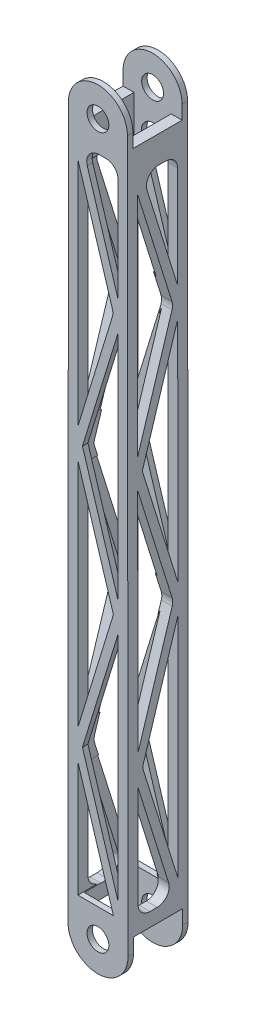
from build123d import *

# Parameters (mm, degrees)
SKETCH1_R               = 10
BOSS_EXTRUDE2_DEPTH     = 5
BOSS_EXTRUDE3_DEPTH     = 55
BOSS_EXTRUDE4_START     = 50
SKETCH1_4_R             = 10
BOSS_EXTRUDE4_DEPTH     = 5
CUT_EXTRUDE2_DEPTH      = 682.432576538
CUT_EXTRUDE2_DEPTH_BACK = 682.432576538
CUT_EXTRUDE4_DEPTH      = 680.786915143
CUT_EXTRUDE4_DEPTH_BACK = 680.786915143
FILLET1_R               = 11
FILLET2_R               = 11


with BuildPart() as part:
    # Sketch1 → Boss-Extrude2 (new body)
    with BuildSketch(Plane.XY):
        with BuildLine():
            Line((27.00967764, 637.419067567), (27, 650))
            ThreePointArc((27, 650), (11.628325989, 674.367643191), (-16.983854422, 670.989251749))
            ThreePointArc((-16.983854422, 670.989251749), (-24.367643191, 661.628325989), (-27, 650))
            Line((-27, 650), (-27.00967764, 637.419067567))
            Line((-27.00967764, 637.419067567), (-17.00967764, 637.419067567))
            Line((-17.00967764, 637.419067567), (-17.490017949, 12.976666451))
            Line((-17.490017949, 12.976666451), (-27.490017949, 12.976666451))
            Line((-27.490017949, 12.976666451), (-27.5, 0))
            ThreePointArc((-27.5, 0), (0, -27.5), (27.5, 0))
            Line((27.5, 0), (27.490017949, 12.976666451))
            Line((27.490017949, 12.976666451), (17.490017949, 12.976666451))
            Line((17.490017949, 12.976666451), (17.00967764, 637.419067567))
            Line((17.00967764, 637.419067567), (27.00967764, 637.419067567))
        make_face()
        Circle(SKETCH1_R, mode=Mode.SUBTRACT)
        with Locations((0, 650)):
            Circle(SKETCH1_R, mode=Mode.SUBTRACT)
    extrude(amount=BOSS_EXTRUDE2_DEPTH)

    # Sketch1<3> → Boss-Extrude3 (add)
    with BuildSketch(Plane.XY):
        Polygon((27.490017949, 12.976666451), (27.00967764, 637.419067567), (17.00967764, 637.419067567), (17.490017949, 12.976666451), align=None)
        Polygon((-17.00967764, 637.419067567), (-27.00967764, 637.419067567), (-27.490017949, 12.976666451), (-17.490017949, 12.976666451), align=None)
    extrude(amount=BOSS_EXTRUDE3_DEPTH)

    # Sketch1<4> → Boss-Extrude4 (add)
    with BuildSketch(Plane.XY.offset(BOSS_EXTRUDE4_START)):
        with BuildLine():
            Line((27, 650), (27.5, 0))
            ThreePointArc((27.5, 0), (0, -27.5), (-27.5, 0))
            Line((-27.5, 0), (-27, 650))
            ThreePointArc((-27, 650), (0, 677), (27, 650))
        make_face()
        Circle(SKETCH1_4_R, mode=Mode.SUBTRACT)
        with Locations((0, 650)):
            Circle(SKETCH1_4_R, mode=Mode.SUBTRACT)
    extrude(amount=BOSS_EXTRUDE4_DEPTH)

    # Sketch3 → Cut-Extrude2 (cut, two sides: drawn at the far end of the back side and taken through both)
    with BuildSketch(Plane(origin=(27.499983728, 0.021153834, 0), x_dir=(0, 0, -1), z_dir=(0.9999997041421431, 0.0007692305416477978, 0)).offset(-CUT_EXTRUDE2_DEPTH_BACK)):
        Polygon((-9.15125207, 39.004247167), (-9.15125207, 246.975679911), (-41.657857257, 142.989963539), align=None)
        Polygon((-45.84874793, 25.600016011), (-13.342784359, 25.600016011), (-45.84874793, 129.583679911), align=None)
        Polygon((-13.342142743, 260.381963539), (-45.84874793, 364.367679911), (-45.84874793, 156.396247167), align=None)
        Polygon((-9.15125207, 273.788247167), (-9.15125207, 481.759679911), (-41.657857257, 377.773963539), align=None)
        Polygon((-9.15125207, 508.572247167), (-9.15125207, 612.557963539), (-41.657857257, 612.557963539), align=None)
        Polygon((-13.342142743, 495.165963539), (-45.84874793, 599.151679911), (-45.84874793, 391.180247167), align=None)
    extrude(amount=CUT_EXTRUDE2_DEPTH + CUT_EXTRUDE2_DEPTH_BACK, mode=Mode.SUBTRACT)

    # Sketch4 → Cut-Extrude4 (cut, two sides: drawn at the far end of the back side and taken through both)
    with BuildSketch(Plane.XY.offset(55).offset(-CUT_EXTRUDE4_DEPTH_BACK)):
        Polygon((14.164977662, 264.312281668), (-18.35, 369.999248569), (-18.35, 158.625314767), align=None)
        Polygon((18.35, 277.915314767), (18.35, 383.602281668), (-14.164977662, 383.602281668), align=None)
        Polygon((18.35, 39.335314767), (18.35, 250.709248569), (-14.164977662, 145.022281668), align=None)
        Polygon((14.164977662, 502.892281668), (-18.35, 608.579248569), (-18.35, 397.205314767), align=None)
        Polygon((18.35, 383.602281668), (18.35, 489.289248569), (-14.164977662, 383.602281668), align=None)
        Polygon((18.35, 516.495314767), (18.35, 622.182281668), (-14.164977662, 622.182281668), align=None)
        Polygon((14.164712586, 25.733143274), (-18.35, 131.419248569), (-18.35, 25.733143274), align=None)
    extrude(amount=CUT_EXTRUDE4_DEPTH + CUT_EXTRUDE4_DEPTH_BACK, mode=Mode.SUBTRACT)

    # Fillet1
    # the kernel refuses this fillet: 11 mm, written as the material it adds along each edge
    with BuildSketch(Plane(origin=(20.380228063, 612.573821868, 41.657857257), x_dir=(0, 0, -1), z_dir=(-0.9999997041421432, -0.0007692305416478183, 0))) as fillet1_piece_1_section:
        with BuildLine():
            CenterArc((FILLET1_R * 1.36032911396, FILLET1_R), FILLET1_R, 162.640419254, 107.359580746)
            Line((FILLET1_R * 0.405878064858, FILLET1_R * 1.29836754995), (0, 0))
            Line((0, 0), (FILLET1_R * 1.36032911396, 0))
        make_face()
    fillet1_piece_1 = extrude(amount=84.818110144, mode=Mode.PRIVATE)
    fillet1_piece_1 = split(fillet1_piece_1, bisect_by=Plane(origin=(-17.030633595, 610.176326445, 36.866673166), z_dir=(-0.9999997041421432, 0.000769230541647673, 0)), keep=Keep.TOP, mode=Mode.PRIVATE)
    fillet1_piece_1 = split(fillet1_piece_1, bisect_by=Plane(origin=(-18.73880131, 609.843011736, 36.866673166), z_dir=(0.9557894024833086, 0.2940520669891645, 0)), keep=Keep.TOP, mode=Mode.PRIVATE)
    add(fillet1_piece_1)
    with BuildSketch(Plane(origin=(20.380228063, 612.573821868, 41.657857257), x_dir=(0, 0, -1), z_dir=(-0.9999997041421432, -0.0007692305416478183, 0))) as fillet1_piece_2_section:
        with BuildLine():
            CenterArc((FILLET1_R * 1.36032911396, FILLET1_R), FILLET1_R, 162.640419254, 107.359580746)
            Line((FILLET1_R * 0.405878064858, FILLET1_R * 1.29836754995), (0, 0))
            Line((0, 0), (FILLET1_R * 1.36032911396, 0))
        make_face()
    fillet1_piece_2 = extrude(amount=84.818110144, mode=Mode.PRIVATE)
    fillet1_piece_2 = split(fillet1_piece_2, bisect_by=Plane(origin=(-27.031488651, 609.064753274, 37.148122223), z_dir=(0.9999997041421432, -0.0007692305416479086, 0)), keep=Keep.TOP, mode=Mode.PRIVATE)
    fillet1_piece_2 = split(fillet1_piece_2, bisect_by=Plane(origin=(-18.35, 609.061582513, 37.148122223), z_dir=(-1, 0, 0)), keep=Keep.TOP, mode=Mode.PRIVATE)
    add(fillet1_piece_2)
    with BuildSketch(Plane(origin=(-54.528809284, 612.516199531, 9.15125207), x_dir=(0, 0, 1), z_dir=(0.9999997041421432, 0.0007692305416478183, 0))) as fillet1_piece_3_section:
        with BuildLine():
            CenterArc((FILLET1_R, FILLET1_R), FILLET1_R, 180, 90)
            Line((0, FILLET1_R), (0, 0))
            Line((0, 0), (FILLET1_R, 0))
        make_face()
    fillet1_piece_3 = extrude(amount=65.000008876, mode=Mode.PRIVATE)
    fillet1_piece_3 = split(fillet1_piece_3, bisect_by=Plane(origin=(-27.030780425, 609.985446876, 11.541019747), z_dir=(0.9999997041421432, -0.0007692305416479086, 0)), keep=Keep.TOP, mode=Mode.PRIVATE)
    fillet1_piece_3 = split(fillet1_piece_3, bisect_by=Plane(origin=(-18.35, 609.982321929, 11.541019747), z_dir=(-1, 0, 0)), keep=Keep.TOP, mode=Mode.PRIVATE)
    add(fillet1_piece_3)
    with BuildSketch(Plane(origin=(-54.528809284, 612.516199531, 9.15125207), x_dir=(0, 0, 1), z_dir=(0.9999997041421432, 0.0007692305416478183, 0))) as fillet1_piece_4_section:
        with BuildLine():
            CenterArc((FILLET1_R, FILLET1_R), FILLET1_R, 180, 90)
            Line((0, FILLET1_R), (0, 0))
            Line((0, 0), (FILLET1_R, 0))
        make_face()
    fillet1_piece_4 = extrude(amount=65.000008876, mode=Mode.PRIVATE)
    fillet1_piece_4 = split(fillet1_piece_4, bisect_by=Plane(origin=(-18.826050938, 610.126608689, 11.792449783), z_dir=(0.9557894024833086, 0.2940520669891645, 0)), keep=Keep.TOP, mode=Mode.PRIVATE)
    fillet1_piece_4 = split(fillet1_piece_4, bisect_by=Plane(origin=(-17.030397772, 610.482896731, 11.792449783), z_dir=(-0.9999997041421432, 0.000769230541647673, 0)), keep=Keep.TOP, mode=Mode.PRIVATE)
    add(fillet1_piece_4)
    with BuildSketch(Plane(origin=(27.480291414, 25.621162271, 13.342784359), x_dir=(-0.0007341928974791893, 0.9544507667229525, 0.2983675499493158), z_dir=(-0.9999997041421432, -0.0007692305416477974, 0))) as fillet1_piece_5_section:
        with BuildLine():
            CenterArc((FILLET1_R * 1.36032911396, -FILLET1_R), FILLET1_R, 90, 107.359580746)
            Line((FILLET1_R * 0.405878064858, -FILLET1_R * 1.29836754995), (0, 0))
            Line((0, 0), (FILLET1_R * 1.36032911396, 0))
        make_face()
    fillet1_piece_5 = extrude(amount=47.409047675, mode=Mode.PRIVATE)
    fillet1_piece_5 = split(fillet1_piece_5, bisect_by=Plane(origin=(18.35, 29.459204727, 17.720701892), z_dir=(1, 0, 0)), keep=Keep.TOP, mode=Mode.PRIVATE)
    add(fillet1_piece_5)
    with BuildSketch(Plane(origin=(64.88933098, 25.649938455, 13.342784359), x_dir=(-0.0007341928974791892, 0.9544507667229523, 0.29836754994931636), z_dir=(-0.9999997041421432, -0.0007692305416477974, 0))) as fillet1_piece_6_section:
        with BuildLine():
            CenterArc((FILLET1_R * 1.36032911396, -FILLET1_R), FILLET1_R, 90, 107.359580746)
            Line((FILLET1_R * 0.405878064858, -FILLET1_R * 1.29836754995), (0, 0))
            Line((0, 0), (FILLET1_R * 1.36032911396, 0))
        make_face()
    fillet1_piece_6 = extrude(amount=47.409047675, mode=Mode.PRIVATE)
    fillet1_piece_6 = split(fillet1_piece_6, bisect_by=Plane(origin=(21.193639859, 30.092322974, 17.822178534), z_dir=(-0.9557894024833083, -0.29405206698916503, 0)), keep=Keep.TOP, mode=Mode.PRIVATE)
    add(fillet1_piece_6)
    with BuildSketch(Plane(origin=(64.88933098, 25.649938455, 13.342784359), x_dir=(-0.0007341928974791892, 0.9544507667229523, 0.29836754994931636), z_dir=(-0.9999997041421432, -0.0007692305416477974, 0))) as fillet1_piece_7_section:
        with BuildLine():
            CenterArc((FILLET1_R * 1.36032911396, -FILLET1_R), FILLET1_R, 90, 107.359580746)
            Line((FILLET1_R * 0.405878064858, -FILLET1_R * 1.29836754995), (0, 0))
            Line((0, 0), (FILLET1_R * 1.36032911396, 0))
        make_face()
    fillet1_piece_7 = extrude(amount=84.818098309, mode=Mode.PRIVATE)
    fillet1_piece_7 = split(fillet1_piece_7, bisect_by=Plane(origin=(-17.480263044, 25.65804338, 20.24450043), z_dir=(-0.9999997041421432, 0.000769230541647673, 0)), keep=Keep.TOP, mode=Mode.PRIVATE)
    fillet1_piece_7 = split(fillet1_piece_7, bisect_by=Plane(origin=(-17.915446561, 25.733143274, 20.24450043), z_dir=(0, -1, 0)), keep=Keep.TOP, mode=Mode.PRIVATE)
    add(fillet1_piece_7)
    with BuildSketch(Plane(origin=(64.88933098, 25.649938455, 13.342784359), x_dir=(-0.0007341928974791892, 0.9544507667229523, 0.29836754994931636), z_dir=(-0.9999997041421432, -0.0007692305416477974, 0))) as fillet1_piece_8_section:
        with BuildLine():
            CenterArc((FILLET1_R * 1.36032911396, -FILLET1_R), FILLET1_R, 90, 107.359580746)
            Line((FILLET1_R * 0.405878064858, -FILLET1_R * 1.29836754995), (0, 0))
            Line((0, 0), (FILLET1_R * 1.36032911396, 0))
        make_face()
    fillet1_piece_8 = extrude(amount=84.818098309, mode=Mode.PRIVATE)
    fillet1_piece_8 = split(fillet1_piece_8, bisect_by=Plane(origin=(-18.35, 29.07733559, 17.806424063), z_dir=(-1, 0, 0)), keep=Keep.TOP, mode=Mode.PRIVATE)
    add(fillet1_piece_8)
    with BuildSketch(Plane(origin=(17.480297331, 25.613469968, 45.84874793), x_dir=(0, 0, -1), z_dir=(0.9999997041421432, 0.0007692305416477974, 0))) as fillet1_piece_9:
        with BuildLine():
            CenterArc((FILLET1_R, FILLET1_R), FILLET1_R, 180, 90)
            Line((0, FILLET1_R), (0, 0))
            Line((0, 0), (FILLET1_R, 0))
        make_face()
    extrude(amount=9.999997041)
    with BuildSketch(Plane(origin=(19.928721549, 25.615353371, 13.342784359), x_dir=(0, 0, 1), z_dir=(-0.9999997041421432, -0.0007692305416477974, 0))) as fillet1_piece_10_section:
        with BuildLine():
            CenterArc((FILLET1_R * 1.36032911396, FILLET1_R), FILLET1_R, 162.640419254, 107.359580746)
            Line((FILLET1_R * 0.405878064858, FILLET1_R * 1.29836754995), (0, 0))
            Line((0, 0), (FILLET1_R * 1.36032911396, 0))
        make_face()
    fillet1_piece_10 = extrude(amount=84.818110144, mode=Mode.PRIVATE)
    fillet1_piece_10 = split(fillet1_piece_10, bisect_by=Plane(origin=(17.480252518, 25.671726879, 20.301923565), z_dir=(0.9999997041421432, 0.000769230541647673, 0)), keep=Keep.TOP, mode=Mode.PRIVATE)
    fillet1_piece_10 = split(fillet1_piece_10, bisect_by=Plane(origin=(22.257957657, 26.632855125, 20.301923565), z_dir=(-0.9557894024833083, -0.29405206698916503, 0)), keep=Keep.TOP, mode=Mode.PRIVATE)
    add(fillet1_piece_10)
    with BuildSketch(Plane(origin=(19.928721549, 25.615353371, 13.342784359), x_dir=(0, 0, 1), z_dir=(-0.9999997041421432, -0.0007692305416477974, 0))) as fillet1_piece_11_section:
        with BuildLine():
            CenterArc((FILLET1_R * 1.36032911396, FILLET1_R), FILLET1_R, 162.640419254, 107.359580746)
            Line((FILLET1_R * 0.405878064858, FILLET1_R * 1.29836754995), (0, 0))
            Line((0, 0), (FILLET1_R * 1.36032911396, 0))
        make_face()
    fillet1_piece_11 = extrude(amount=84.818110144, mode=Mode.PRIVATE)
    fillet1_piece_11 = split(fillet1_piece_11, bisect_by=Plane(origin=(18.35, 36.511901579, 17.057694277), z_dir=(1, 0, 0)), keep=Keep.TOP, mode=Mode.PRIVATE)
    add(fillet1_piece_11)
    with BuildSketch(Plane(origin=(19.928721549, 25.615353371, 13.342784359), x_dir=(0, 0, 1), z_dir=(-0.9999997041421432, -0.0007692305416477974, 0))) as fillet1_piece_12_section:
        with BuildLine():
            CenterArc((FILLET1_R * 1.36032911396, FILLET1_R), FILLET1_R, 162.640419254, 107.359580746)
            Line((FILLET1_R * 0.405878064858, FILLET1_R * 1.29836754995), (0, 0))
            Line((0, 0), (FILLET1_R * 1.36032911396, 0))
        make_face()
    fillet1_piece_12 = extrude(amount=84.818110144, mode=Mode.PRIVATE)
    fillet1_piece_12 = split(fillet1_piece_12, bisect_by=Plane(origin=(-27.480257126, 25.665735683, 20.244500453), z_dir=(0.9999997041421432, -0.0007692305416479086, 0)), keep=Keep.TOP, mode=Mode.PRIVATE)
    fillet1_piece_12 = split(fillet1_piece_12, bisect_by=Plane(origin=(-17.480263044, 25.65804338, 20.244500453), z_dir=(-0.9999997041421432, 0.000769230541647673, 0)), keep=Keep.TOP, mode=Mode.PRIVATE)
    fillet1_piece_12 = split(fillet1_piece_12, bisect_by=Plane(origin=(-17.915446556, 25.733143274, 20.244500453), z_dir=(0, -1, 0)), keep=Keep.TOP, mode=Mode.PRIVATE)
    add(fillet1_piece_12)
    with BuildSketch(Plane(origin=(19.928721549, 25.615353371, 13.342784359), x_dir=(0, 0, 1), z_dir=(-0.9999997041421432, -0.0007692305416477974, 0))) as fillet1_piece_13_section:
        with BuildLine():
            CenterArc((FILLET1_R * 1.36032911396, FILLET1_R), FILLET1_R, 162.640419254, 107.359580746)
            Line((FILLET1_R * 0.405878064858, FILLET1_R * 1.29836754995), (0, 0))
            Line((0, 0), (FILLET1_R * 1.36032911396, 0))
        make_face()
    fillet1_piece_13 = extrude(amount=84.818110144, mode=Mode.PRIVATE)
    fillet1_piece_13 = split(fillet1_piece_13, bisect_by=Plane(origin=(-27.477633612, 29.076303988, 17.805926532), z_dir=(0.9999997041421432, -0.0007692305416479086, 0)), keep=Keep.TOP, mode=Mode.PRIVATE)
    fillet1_piece_13 = split(fillet1_piece_13, bisect_by=Plane(origin=(-18.35, 29.072792266, 17.805926532), z_dir=(-1, 0, 0)), keep=Keep.TOP, mode=Mode.PRIVATE)
    add(fillet1_piece_13)
    with BuildSketch(Plane(origin=(-54.980315799, 25.557731035, 45.84874793), x_dir=(0, 0, -1), z_dir=(0.9999997041421432, 0.0007692305416477974, 0))) as fillet1_piece_14_section:
        with BuildLine():
            CenterArc((FILLET1_R, FILLET1_R), FILLET1_R, 180, 90)
            Line((0, FILLET1_R), (0, 0))
            Line((0, 0), (FILLET1_R, 0))
        make_face()
    fillet1_piece_14 = extrude(amount=65.000008876, mode=Mode.PRIVATE)
    fillet1_piece_14 = split(fillet1_piece_14, bisect_by=Plane(origin=(-27.480262015, 25.659380878, 40.945234597), z_dir=(0.9999997041421432, -0.0007692305416479086, 0)), keep=Keep.TOP, mode=Mode.PRIVATE)
    fillet1_piece_14 = split(fillet1_piece_14, bisect_by=Plane(origin=(-18.35, 25.655894828, 40.945234597), z_dir=(-1, 0, 0)), keep=Keep.TOP, mode=Mode.PRIVATE)
    add(fillet1_piece_14)
    with BuildSketch(Plane(origin=(-54.980315799, 25.557731035, 45.84874793), x_dir=(0, 0, -1), z_dir=(0.9999997041421432, 0.0007692305416477974, 0))) as fillet1_piece_15_section:
        with BuildLine():
            CenterArc((FILLET1_R, FILLET1_R), FILLET1_R, 180, 90)
            Line((0, FILLET1_R), (0, 0))
            Line((0, 0), (FILLET1_R, 0))
        make_face()
    fillet1_piece_15 = extrude(amount=65.000008876, mode=Mode.PRIVATE)
    fillet1_piece_15 = split(fillet1_piece_15, bisect_by=Plane(origin=(-17.480263406, 25.657571636, 40.937712077), z_dir=(-0.9999997041421432, 0.000769230541647673, 0)), keep=Keep.TOP, mode=Mode.PRIVATE)
    fillet1_piece_15 = split(fillet1_piece_15, bisect_by=Plane(origin=(-17.91544154, 25.733143274, 40.937712077), z_dir=(0, -1, 0)), keep=Keep.TOP, mode=Mode.PRIVATE)
    fillet1_piece_15 = split(fillet1_piece_15, bisect_by=Plane(origin=(-18.35, 25.657906389, 40.937712077), z_dir=(1, 0, 0)), keep=Keep.TOP, mode=Mode.PRIVATE)
    add(fillet1_piece_15)
    with BuildSketch(Plane(origin=(27.389991481, 143.011075068, 41.657857257), x_dir=(0.0007341928974791895, -0.9544507667229527, -0.2983675499493152), z_dir=(-0.9999997041421432, -0.0007692305416477974, 0))) as fillet1_piece_16_section:
        with BuildLine():
            CenterArc((FILLET1_R * 0.312606445589, -FILLET1_R), FILLET1_R, 90, 34.719161491)
            Line((-FILLET1_R * 0.256947996547, -FILLET1_R * 0.178046389726), (0, 0))
            Line((0, 0), (FILLET1_R * 0.312606445589, 0))
        make_face()
    fillet1_piece_16 = extrude(amount=17.636671409, mode=Mode.PRIVATE)
    fillet1_piece_16 = split(fillet1_piece_16, bisect_by=Plane(origin=(18.35, 143.007505025, 41.24091041), z_dir=(1, 0, 0)), keep=Keep.TOP, mode=Mode.PRIVATE)
    add(fillet1_piece_16)
    with BuildSketch(Plane(origin=(-8.793343267, 142.983241733, 41.657857257), x_dir=(-0.0007341928974791894, 0.9544507667229526, -0.29836754994931564), z_dir=(-0.9999997041421432, -0.0007692305416477974, 0))) as fillet1_piece_17_section:
        with BuildLine():
            CenterArc((FILLET1_R * 0.312606445589, FILLET1_R), FILLET1_R, 235.280838509, 34.719161491)
            Line((-FILLET1_R * 0.256947996547, FILLET1_R * 0.178046389726), (0, 0))
            Line((0, 0), (FILLET1_R * 0.312606445589, 0))
        make_face()
    fillet1_piece_17 = extrude(amount=27.193363383, mode=Mode.PRIVATE)
    fillet1_piece_17 = split(fillet1_piece_17, bisect_by=Plane(origin=(-27.390017978, 142.976628902, 41.24091041), z_dir=(0.9999997041421432, -0.0007692305416479086, 0)), keep=Keep.TOP, mode=Mode.PRIVATE)
    fillet1_piece_17 = split(fillet1_piece_17, bisect_by=Plane(origin=(-17.390023895, 142.968936599, 41.24091041), z_dir=(-0.9999997041421432, 0.000769230541647673, 0)), keep=Keep.TOP, mode=Mode.PRIVATE)
    add(fillet1_piece_17)
    with BuildSketch(Plane(origin=(17.299695886, 260.395348033, 13.342142743), x_dir=(-0.0007341928974792087, 0.9544507667229518, 0.298367549949318), z_dir=(0.9999997041421432, 0.0007692305416478183, 0)), Plane(origin=(17.119092863, 495.179278571, 13.342142743), x_dir=(-0.000734192897479209, 0.9544507667229524, 0.2983675499493161), z_dir=(0.9999997041421432, 0.0007692305416478183, 0))) as fillet1_piece_18:
        with BuildLine():
            CenterArc((FILLET1_R * 0.312606445589, FILLET1_R), FILLET1_R, 235.280838509, 34.719161491)
            Line((-FILLET1_R * 0.256947996547, FILLET1_R * 0.178046389726), (0, 0))
            Line((0, 0), (FILLET1_R * 0.312606445589, 0))
        make_face()
    extrude(amount=9.999997041)
    with BuildSketch(Plane(origin=(-35.896396987, 260.354427962, 13.342142743), x_dir=(-0.0007341928974792096, 0.9544507667229529, 0.29836754994931425), z_dir=(0.9999997041421432, 0.0007692305416478183, 0))) as fillet1_piece_19_section:
        with BuildLine():
            CenterArc((FILLET1_R * 0.312606445589, FILLET1_R), FILLET1_R, 235.280838509, 34.719161491)
            Line((-FILLET1_R * 0.256947996547, FILLET1_R * 0.178046389726), (0, 0))
            Line((0, 0), (FILLET1_R * 0.312606445589, 0))
        make_face()
    fillet1_piece_19 = extrude(amount=26.143079432, mode=Mode.PRIVATE)
    fillet1_piece_19 = split(fillet1_piece_19, bisect_by=Plane(origin=(-27.299717053, 260.367831124, 13.75908959), z_dir=(0.9999997041421432, -0.0007692305416479086, 0)), keep=Keep.TOP, mode=Mode.PRIVATE)
    fillet1_piece_19 = split(fillet1_piece_19, bisect_by=Plane(origin=(-18.35, 260.364388927, 13.75908959), z_dir=(-1, 0, 0)), keep=Keep.TOP, mode=Mode.PRIVATE)
    add(fillet1_piece_19)
    with BuildSketch(Plane(origin=(-35.715793749, 495.13863635, 13.342142743), x_dir=(-0.0007341928974792084, 0.9544507667229515, 0.2983675499493189), z_dir=(0.9999997041421432, 0.0007692305416478183, 0))) as fillet1_piece_20_section:
        with BuildLine():
            CenterArc((FILLET1_R * 0.312606445589, FILLET1_R), FILLET1_R, 235.280838509, 34.719161491)
            Line((-FILLET1_R * 0.256947996547, FILLET1_R * 0.178046389726), (0, 0))
            Line((0, 0), (FILLET1_R * 0.312606445589, 0))
        make_face()
    fillet1_piece_20 = extrude(amount=25.962476141, mode=Mode.PRIVATE)
    fillet1_piece_20 = split(fillet1_piece_20, bisect_by=Plane(origin=(-27.119113924, 495.15189865, 13.75908959), z_dir=(0.9999997041421432, -0.0007692305416479086, 0)), keep=Keep.TOP, mode=Mode.PRIVATE)
    fillet1_piece_20 = split(fillet1_piece_20, bisect_by=Plane(origin=(-18.35, 495.148525916, 13.75908959), z_dir=(-1, 0, 0)), keep=Keep.TOP, mode=Mode.PRIVATE)
    add(fillet1_piece_20)
    with BuildSketch(Plane(origin=(14.164977662, 502.892281668, 0), x_dir=(-0.29405206698916386, -0.9557894024833086, 0), z_dir=(0, 0, 1))) as fillet1_piece_21:
        with BuildLine():
            CenterArc((FILLET1_R * 0.307653617235, -FILLET1_R), FILLET1_R, 90, 34.201407741)
            Line((-FILLET1_R * 0.254450081578, -FILLET1_R * 0.172933236201), (0, 0))
            Line((0, 0), (FILLET1_R * 0.307653617235, 0))
        make_face()
    extrude(amount=5)
    with BuildSketch(Plane(origin=(14.164977662, 502.892281668, 50), x_dir=(-0.29405206698916386, 0.9557894024833088, 0), z_dir=(0, 0, 1))) as fillet1_piece_22:
        with BuildLine():
            CenterArc((FILLET1_R * 0.307653617235, FILLET1_R), FILLET1_R, 235.798592259, 34.201407741)
            Line((-FILLET1_R * 0.254450081578, FILLET1_R * 0.172933236201), (0, 0))
            Line((0, 0), (FILLET1_R * 0.307653617235, 0))
        make_face()
    extrude(amount=5)
    with BuildSketch(Plane(origin=(18.35, 622.182281668, 0), x_dir=(-1, 0, 0), z_dir=(0, 0, 1))) as fillet1_piece_23_section:
        with BuildLine():
            CenterArc((FILLET1_R, FILLET1_R), FILLET1_R, 180, 90)
            Line((0, FILLET1_R), (0, 0))
            Line((0, 0), (FILLET1_R, 0))
        make_face()
    fillet1_piece_23 = extrude(amount=82.5, mode=Mode.PRIVATE)
    fillet1_piece_23 = split(fillet1_piece_23, bisect_by=Plane(origin=(14.749570585, 620.572478435, 5), z_dir=(0, 0, -1)), keep=Keep.TOP, mode=Mode.PRIVATE)
    add(fillet1_piece_23)
    with BuildSketch(Plane(origin=(18.35, 622.182281668, 0), x_dir=(-1, 0, 0), z_dir=(0, 0, 1))) as fillet1_piece_24_section:
        with BuildLine():
            CenterArc((FILLET1_R, FILLET1_R), FILLET1_R, 180, 90)
            Line((0, FILLET1_R), (0, 0))
            Line((0, 0), (FILLET1_R, 0))
        make_face()
    fillet1_piece_24 = extrude(amount=55, mode=Mode.PRIVATE)
    fillet1_piece_24 = split(fillet1_piece_24, bisect_by=Plane(origin=(17.024326754, 618.375219629, 7.075626035), z_dir=(0.9999997041421432, 0.000769230541647673, 0)), keep=Keep.TOP, mode=Mode.PRIVATE)
    fillet1_piece_24 = split(fillet1_piece_24, bisect_by=Plane(origin=(17.750367589, 612.571798898, 7.075626035), z_dir=(-0.000769230541647798, 0.9999997041421432, 0)), keep=Keep.TOP, mode=Mode.PRIVATE)
    add(fillet1_piece_24)
    with BuildSketch(Plane(origin=(18.35, 622.182281668, 0), x_dir=(-1, 0, 0), z_dir=(0, 0, 1))) as fillet1_piece_25_section:
        with BuildLine():
            CenterArc((FILLET1_R, FILLET1_R), FILLET1_R, 180, 90)
            Line((0, FILLET1_R), (0, 0))
            Line((0, 0), (FILLET1_R, 0))
        make_face()
    fillet1_piece_25 = extrude(amount=82.5, mode=Mode.PRIVATE)
    fillet1_piece_25 = split(fillet1_piece_25, bisect_by=Plane(origin=(18.323301534, 612.572239616, 7.075626035), z_dir=(0.000769230541647798, -0.9999997041421432, 0)), keep=Keep.TOP, mode=Mode.PRIVATE)
    fillet1_piece_25 = split(fillet1_piece_25, bisect_by=Plane(origin=(18.323568626, 612.22501923, 9.15125207), z_dir=(0, 0, -1)), keep=Keep.TOP, mode=Mode.PRIVATE)
    add(fillet1_piece_25)
    with BuildSketch(Plane(origin=(18.35, 622.182281668, -27.5), x_dir=(-1, 0, 0), z_dir=(0, 0, 1))) as fillet1_piece_26_section:
        with BuildLine():
            CenterArc((FILLET1_R, FILLET1_R), FILLET1_R, 180, 90)
            Line((0, FILLET1_R), (0, 0))
            Line((0, 0), (FILLET1_R, 0))
        make_face()
    fillet1_piece_26 = extrude(amount=82.5, mode=Mode.PRIVATE)
    fillet1_piece_26 = split(fillet1_piece_26, bisect_by=Plane(origin=(14.749570585, 620.572478435, 50), z_dir=(0, 0, 1)), keep=Keep.TOP, mode=Mode.PRIVATE)
    add(fillet1_piece_26)
    with BuildSketch(Plane(origin=(18.35, 622.182281668, -27.5), x_dir=(-1, 0, 0), z_dir=(0, 0, 1))) as fillet1_piece_27_section:
        with BuildLine():
            CenterArc((FILLET1_R, FILLET1_R), FILLET1_R, 180, 90)
            Line((0, FILLET1_R), (0, 0))
            Line((0, 0), (FILLET1_R, 0))
        make_face()
    fillet1_piece_27 = extrude(amount=82.5, mode=Mode.PRIVATE)
    fillet1_piece_27 = split(fillet1_piece_27, bisect_by=Plane(origin=(18.322756239, 613.425741314, 41.924667441), z_dir=(0.00022951343205763856, -0.29836746167493194, 0.9544510491047945)), keep=Keep.TOP, mode=Mode.PRIVATE)
    fillet1_piece_27 = split(fillet1_piece_27, bisect_by=Plane(origin=(18.323412779, 612.572239702, 45.774238318), z_dir=(0.000769230541647798, -0.9999997041421432, 0)), keep=Keep.TOP, mode=Mode.PRIVATE)
    add(fillet1_piece_27)
    with BuildSketch(Plane(origin=(-14.164977662, 622.182281668, 55), x_dir=(1, 0, 0), z_dir=(0, 0, -1)), Plane(origin=(-14.164977662, 622.182281668, 5), x_dir=(1, 0, 0), z_dir=(0, 0, -1))) as fillet1_piece_28:
        with BuildLine():
            CenterArc((FILLET1_R * 1.35390920178, FILLET1_R), FILLET1_R, 162.89929613, 107.10070387)
            Line((FILLET1_R * 0.3981197993, FILLET1_R * 1.29405206699), (0, 0))
            Line((0, 0), (FILLET1_R * 1.35390920178, 0))
        make_face()
    extrude(amount=5)

    # Fillet2
    fillet2_edges = [part.edges().sort_by_distance(p)[0] for p in [
        (22.645310338, 612.575564239, 9.15125207),
        (22.689392717, 612.575598148, 41.657857257),
    ]]
    fillet(fillet2_edges, radius=FILLET2_R)


solid = part.part
